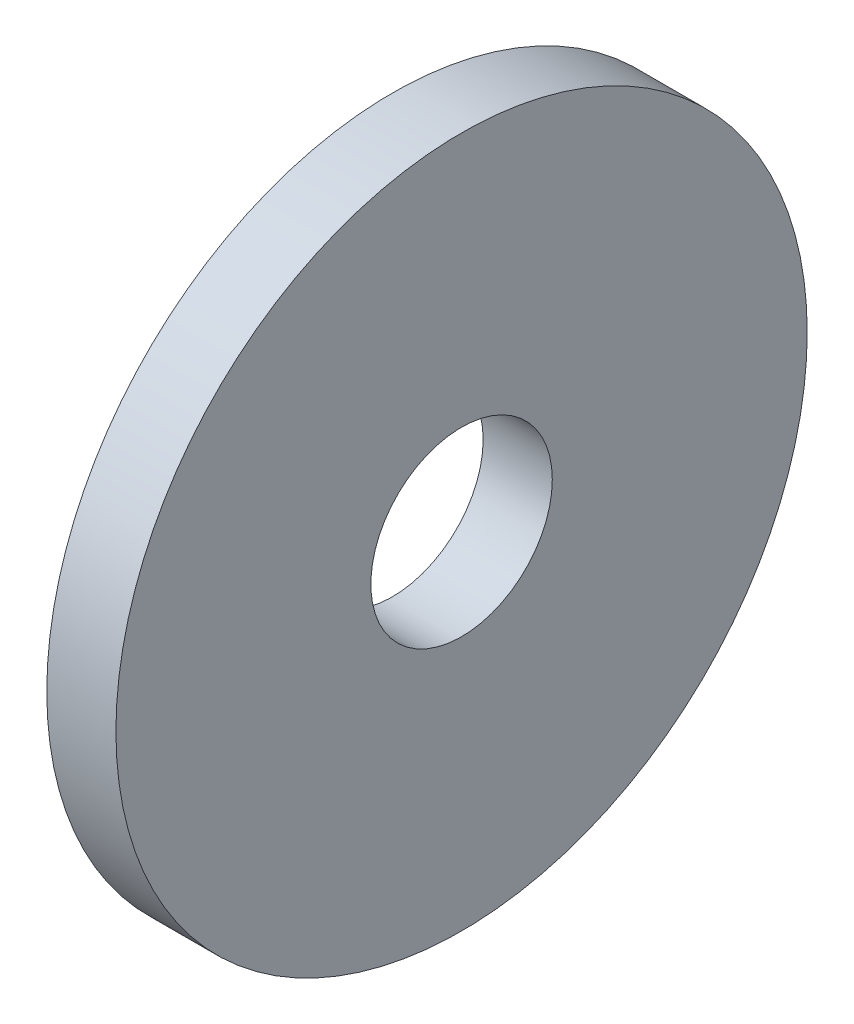
from build123d import *

# Parameters (mm, degrees)
SKETCH_1_R             = 20
SKETCH_1_R_2           = 5.25
SM_BASE_FLANGE_1_DEPTH = 4


# Sheet-metal steps are written as plain solids
with BuildPart() as part:
    # Sketch 1 → Базовая кромка1 (new body)
    with BuildSketch(Plane(origin=(0, 0, 0), x_dir=(0, 0, -1), z_dir=(1, 0, 0))):
        Circle(SKETCH_1_R)
        Circle(SKETCH_1_R_2, mode=Mode.SUBTRACT)
    extrude(amount=-SM_BASE_FLANGE_1_DEPTH)


solid = part.part
